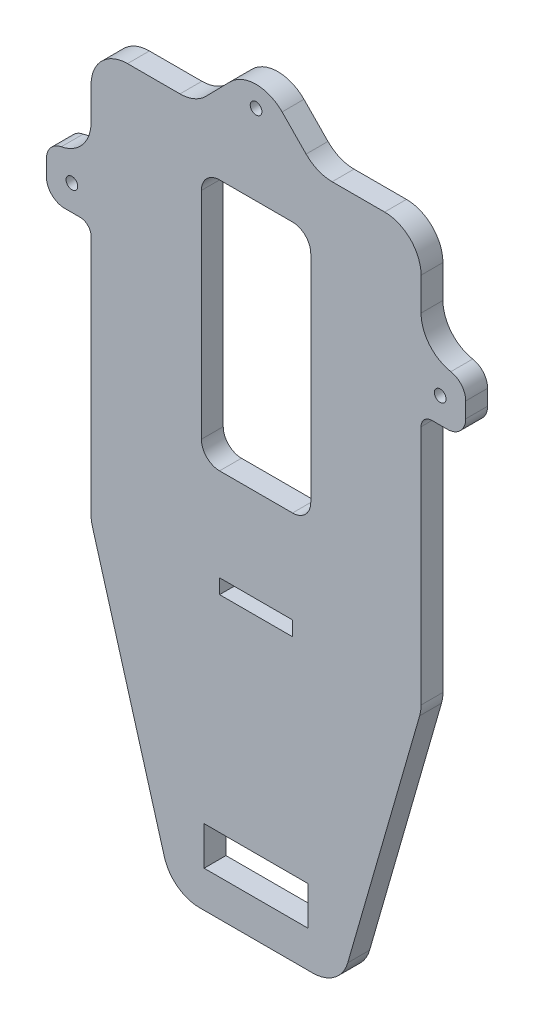
from build123d import *

# Parameters (mm, degrees)
ESBO_O1_W                = 28.5
ESBO_O1_H                = 10.6
ESBO_O1_W_2              = 20
ESBO_O1_H_2              = 4
ESBO_O1_R                = 1.6
ESBO_O1_W_3              = 30
ESBO_O1_H_3              = 69.1
RESSALTO_EXTRUS_O1_DEPTH = 6
FILETE3_R                = 3
FILETE4_R                = 10
FILETE5_R                = 5


with BuildPart() as part:
    # Esboço1 → Ressalto-extrusão1 (new body)
    with BuildSketch(Plane.XY):
        Polygon((-45.25, 13.75), (-45.25, -56.75), (-23.05952475, -133.85), (23.05952475, -133.85), (45.25, -56.75), (45.25, 13.75), (57.5, 13.75), (57.5, 27.75), (45.25, 27.75), (45.25, 56.75), (16.663333, 56.75), (0, 73.75), (-16.663333, 56.75), (-45.25, 56.75), (-45.25, 27.75), (-57.5, 27.75), (-57.5, 13.75), align=None)
        with Locations((0, -118.55)):
            Rectangle(ESBO_O1_W, ESBO_O1_H, mode=Mode.SUBTRACT)
        with Locations((0, -54.75)):
            Rectangle(ESBO_O1_W_2, ESBO_O1_H_2, mode=Mode.SUBTRACT)
        with Locations((-50.5, 20.75)):
            Circle(ESBO_O1_R, mode=Mode.SUBTRACT)
        with Locations((0, 7.2)):
            Rectangle(ESBO_O1_W_3, ESBO_O1_H_3, mode=Mode.SUBTRACT)
        with Locations((0, 63.75)):
            Circle(ESBO_O1_R, mode=Mode.SUBTRACT)
        with Locations((50.5, 20.75)):
            Circle(ESBO_O1_R, mode=Mode.SUBTRACT)
    extrude(amount=RESSALTO_EXTRUS_O1_DEPTH)

    # Filete3
    filete3_edges = [part.edges().sort_by_distance(p)[0] for p in [
        (45.25, 13.75, 3),
        (-45.25, 13.75, 3),
    ]]
    fillet(filete3_edges, radius=FILETE3_R)

    # Filete4
    filete4_edges = [part.edges().sort_by_distance(p)[0] for p in [
        (-16.663333, 56.75, 3),
        (16.663333, 56.75, 3),
        (-45.25, 27.75, 3),
        (45.25, 27.75, 3),
        (0, 73.75, 3),
        (45.25, 56.75, 3),
        (-45.25, 56.75, 3),
        (-45.25, -56.75, 3),
        (45.25, -56.75, 3),
        (23.05952475, -133.85, 3),
        (-23.05952475, -133.85, 3),
    ]]
    fillet(filete4_edges, radius=FILETE4_R)

    # Filete5
    filete5_edges = [part.edges().sort_by_distance(p)[0] for p in [
        (57.5, 13.75, 3),
        (57.5, 27.75, 3),
        (-57.5, 13.75, 3),
        (-57.5, 27.75, 3),
        (-15, -27.35, 3),
        (15, -27.35, 3),
        (15, 41.75, 3),
        (-15, 41.75, 3),
    ]]
    fillet(filete5_edges, radius=FILETE5_R)


solid = part.part
